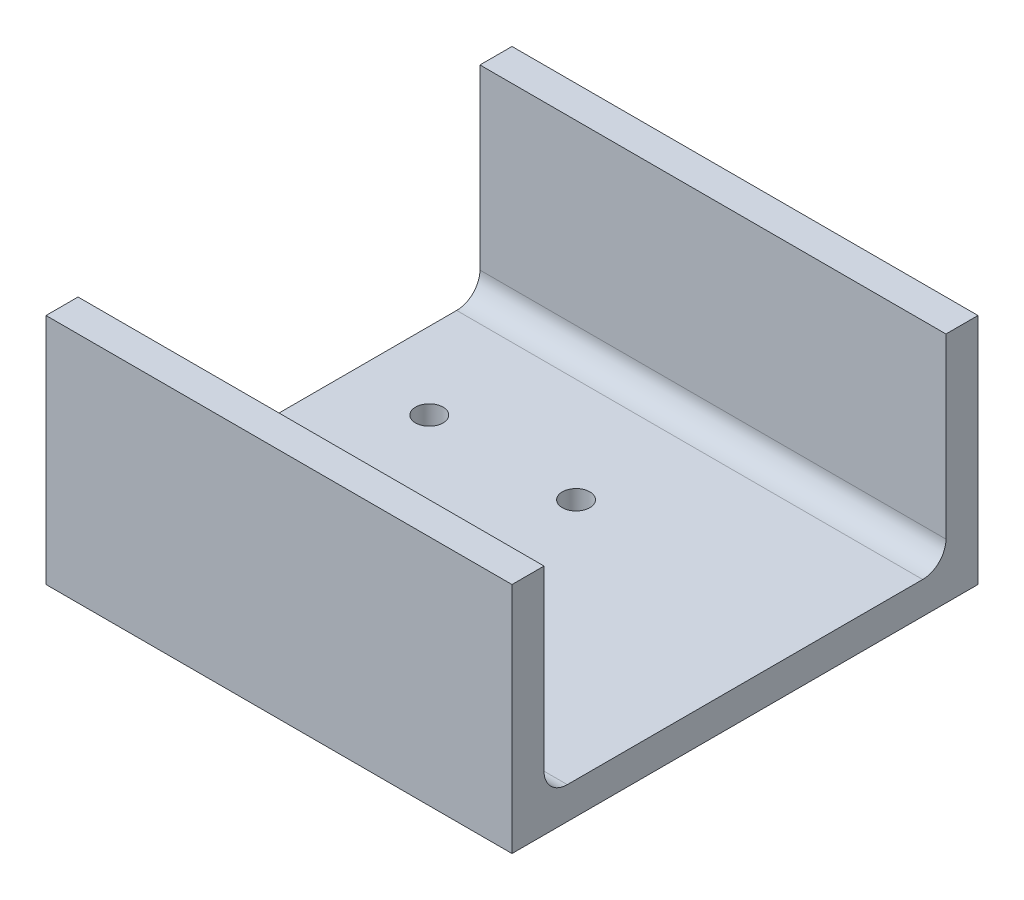
from build123d import *

# Parameters (mm, degrees)
BOSS_EXTRUDE1_DEPTH = 50.8
SKETCH2_R           = 1.5
CUT_EXTRUDE1_DEPTH  = 12.954


with BuildPart() as part:
    # Sketch1 → Boss-Extrude1 (new body)
    with BuildSketch(Plane(origin=(0, 0, 0), x_dir=(0, 0, -1), z_dir=(1, 0, 0))):
        with BuildLine():
            Line((-21.9075, -6.6675), (-21.9075, 9.2075))
            Line((-21.9075, 9.2075), (-21.9075, 12.7))
            Line((-21.9075, 12.7), (-25.4, 12.7))
            Line((-25.4, 12.7), (-25.4, -12.7))
            Line((-25.4, -12.7), (25.4, -12.7))
            Line((25.4, -12.7), (25.4, 12.7))
            Line((25.4, 12.7), (21.9075, 12.7))
            Line((21.9075, 12.7), (21.9075, 9.2075))
            Line((21.9075, 9.2075), (21.9075, -6.6675))
            ThreePointArc((21.9075, -6.6675), (21.163551224, -8.463551224), (19.3675, -9.2075))
            Line((19.3675, -9.2075), (-19.3675, -9.2075))
            ThreePointArc((-19.3675, -9.2075), (-21.163551224, -8.463551224), (-21.9075, -6.6675))
        make_face()
    extrude(amount=BOSS_EXTRUDE1_DEPTH)

    # Sketch2 → Cut-Extrude1 (cut)
    with BuildSketch(Plane.XZ.offset(12.7)):
        with Locations((8.382, 8)):
            Circle(SKETCH2_R)
        with Locations((8.382, -8.002)):
            Circle(SKETCH2_R)
        with Locations((24.382, -8.002)):
            Circle(SKETCH2_R)
        with Locations((24.382, 8)):
            Circle(SKETCH2_R)
    extrude(amount=-CUT_EXTRUDE1_DEPTH, mode=Mode.SUBTRACT)


solid = part.part
